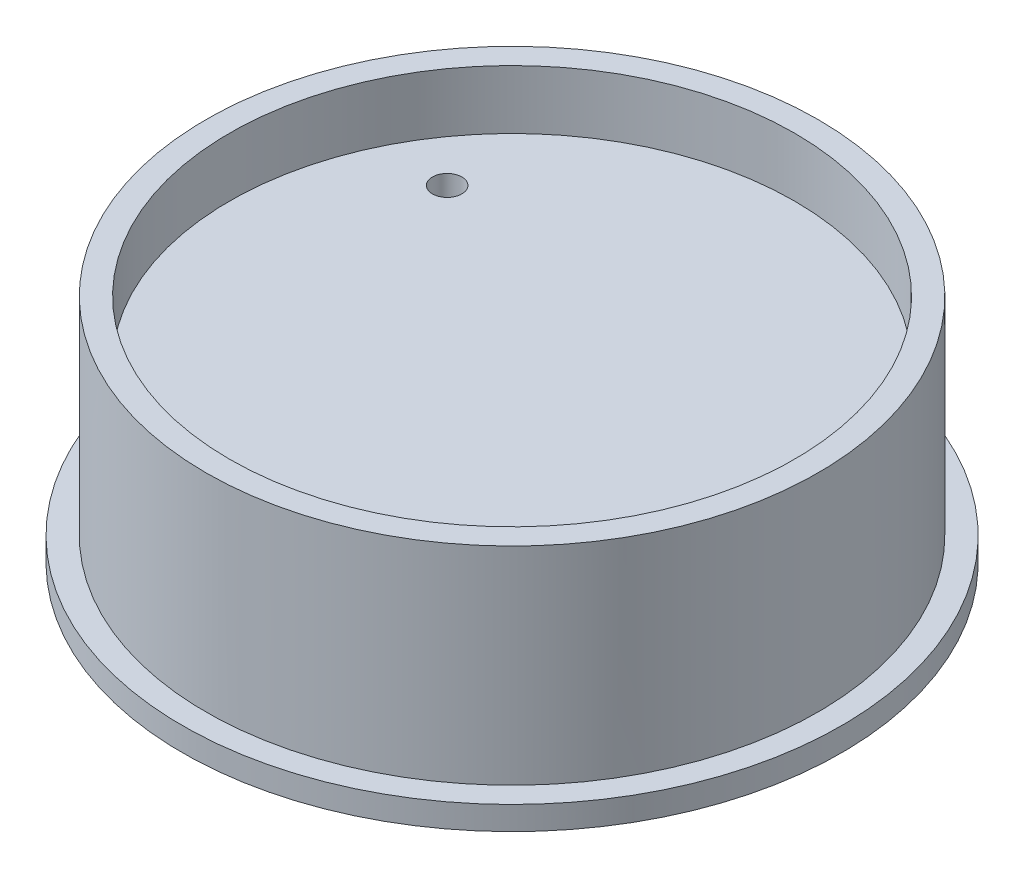
from build123d import *

# Parameters (mm, degrees)
SKETCH_1_R      = 26
SKETCH_1_R_2    = 24
EXTRUDE_1_DEPTH = 12.6
SKETCH_2_R      = 28
SKETCH_2_R_2    = 26
EXTRUDE_2_DEPTH = 2
SKETCH_3_R      = 26
EXTRUDE_3_DEPTH = 2
SKETCH_4_R      = 26
SKETCH_4_R_2    = 24
EXTRUDE_4_DEPTH = 5
EXTRUDE_START   = 11
EXTRUDE_5_DEPTH = 11
M3X0_51_D       = 2.5


with BuildPart() as part:
    # Эскиз1 → Бобышка-Вытянуть1 (new body)
    with BuildSketch(Plane(origin=(0, 0, 0), x_dir=(1, 0, 0), z_dir=(0, 1, 0))):
        Circle(SKETCH_1_R)
        Circle(SKETCH_1_R_2, mode=Mode.SUBTRACT)
    extrude(amount=EXTRUDE_1_DEPTH)

    # Эскиз2 → Бобышка-Вытянуть2 (add)
    with BuildSketch(Plane.XZ):
        Circle(SKETCH_2_R)
        Circle(SKETCH_2_R_2, mode=Mode.SUBTRACT)
    extrude(amount=-EXTRUDE_2_DEPTH)

    # Эскиз3 → Бобышка-Вытянуть3 (add)
    with BuildSketch(Plane(origin=(0, 12.6, 0), x_dir=(1, 0, 0), z_dir=(0, 1, 0))):
        Circle(SKETCH_3_R)
    extrude(amount=EXTRUDE_3_DEPTH)

    # Эскиз4 → Бобышка-Вытянуть4 (add)
    with BuildSketch(Plane(origin=(0, 14.6, 0), x_dir=(1, 0, 0), z_dir=(0, 1, 0))):
        Circle(SKETCH_4_R)
        Circle(SKETCH_4_R_2, mode=Mode.SUBTRACT)
    extrude(amount=EXTRUDE_4_DEPTH)

    # Эскиз5 → Бобышка-Вытянуть5 (add)
    with BuildSketch(Plane.XZ.offset(-12.6).offset(EXTRUDE_START)):
        with BuildLine():
            Line((13.991908497, 13.322030499), (17.962953288, 15.916416342))
            ThreePointArc((17.962953288, 15.916416342), (20.092058504, 13.126659326), (21.791562258, 10.056232611))
            Line((21.791562258, 10.056232611), (17.820517467, 7.461846768))
            ThreePointArc((17.820517467, 7.461846768), (12.976121117, 8.477634148), (13.991908497, 13.322030499))
        make_face()
        with BuildLine():
            Line((-13.991908497, -13.322030499), (-17.962953288, -15.916416342))
            ThreePointArc((-17.962953288, -15.916416342), (-20.092058504, -13.126659326), (-21.791562258, -10.056232611))
            Line((-21.791562258, -10.056232611), (-17.820517467, -7.461846768))
            ThreePointArc((-17.820517467, -7.461846768), (-12.976121117, -8.477634148), (-13.991908497, -13.322030499))
        make_face()
    extrude(amount=-EXTRUDE_5_DEPTH)

    # Отверстие обработанное метчиком M3x0.51 (through all)
    with Locations(Plane(origin=(0, 1.6, 0), x_dir=(-1, 0, 0), z_dir=(0, -1, 0))):
        with Locations((-15.906212982, -10.391938633), (15.906212982, 10.391938633)):
            Hole(M3X0_51_D / 2)


solid = part.part
